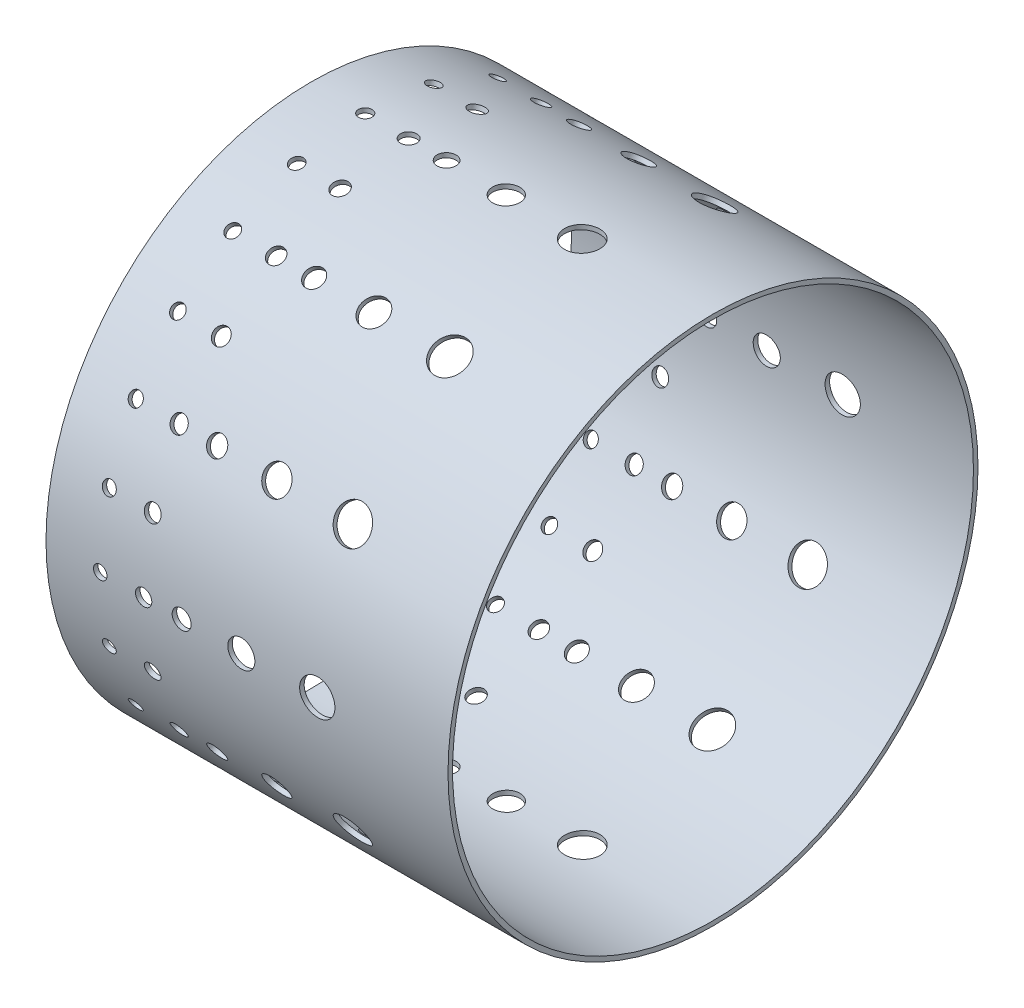
from build123d import *

# Parameters (mm, degrees)
SKETCH1_R           = 48.8442
SKETCH1_R_2         = 48.006
BOSS_EXTRUDE1_DEPTH = 74.09688
SKETCH2_R           = 1.25
CUT_EXTRUDE1_DEPTH  = 102.300835994
CIRPATTERN1_COUNT   = 24
SKETCH4_R           = 1.5
CUT_EXTRUDE2_DEPTH  = 102.300836166
CIRPATTERN2_COUNT   = 24
SKETCH5_R           = 1.75
CUT_EXTRUDE3_DEPTH  = 102.300836168
CIRPATTERN3_COUNT   = 12
SKETCH6_R           = 2.5
CUT_EXTRUDE4_DEPTH  = 102.300836173
CIRPATTERN4_COUNT   = 12
SKETCH7_R           = 3.25
CUT_EXTRUDE5_DEPTH  = 102.300836173
CIRPATTERN5_COUNT   = 12


with BuildPart() as part:
    # Sketch1 → Boss-Extrude1 (new body)
    with BuildSketch(Plane(origin=(0, 0, 0), x_dir=(0, 0, -1), z_dir=(1, 0, 0))):
        Circle(SKETCH1_R)
        Circle(SKETCH1_R_2, mode=Mode.SUBTRACT)
    extrude(amount=BOSS_EXTRUDE1_DEPTH)

    # Sketch2 → Cut-Extrude1 (cut, through all)
    with BuildSketch(Plane(origin=(0, 0, 0), x_dir=(1, 0, 0), z_dir=(0, 1, 0))):
        with Locations((10, 0)):
            Circle(SKETCH2_R)
    cut_extrude1 = extrude(amount=-CUT_EXTRUDE1_DEPTH, mode=Mode.SUBTRACT)

    # CirPattern1: Cut-Extrude1 ×24 about axis
    cirpattern1_axis = Axis((0, 0, 0), (1, 0, 0))
    for i in range(1, CIRPATTERN1_COUNT):
        add(cut_extrude1.rotate(cirpattern1_axis, i * 360 / CIRPATTERN1_COUNT), mode=Mode.SUBTRACT)

    # Sketch4 → Cut-Extrude2 (cut, through all)
    with BuildSketch(Plane.XY):
        with Locations((18, 0)):
            Circle(SKETCH4_R)
    cut_extrude2 = extrude(amount=-CUT_EXTRUDE2_DEPTH, mode=Mode.SUBTRACT)

    # CirPattern2: Cut-Extrude2 ×24 about axis
    cirpattern2_axis = Axis((0, 0, 0), (1, 0, 0))
    for i in range(1, CIRPATTERN2_COUNT):
        add(cut_extrude2.rotate(cirpattern2_axis, i * 360 / CIRPATTERN2_COUNT), mode=Mode.SUBTRACT)

    # Sketch5 → Cut-Extrude3 (cut, through all)
    with BuildSketch(Plane.XY):
        with Locations((25, 0)):
            Circle(SKETCH5_R)
    cut_extrude3 = extrude(amount=-CUT_EXTRUDE3_DEPTH, mode=Mode.SUBTRACT)

    # CirPattern3: Cut-Extrude3 ×12 about axis
    cirpattern3_axis = Axis((0, 0, 0), (1, 0, 0))
    for i in range(1, CIRPATTERN3_COUNT):
        add(cut_extrude3.rotate(cirpattern3_axis, i * 360 / CIRPATTERN3_COUNT), mode=Mode.SUBTRACT)

    # Sketch6 → Cut-Extrude4 (cut, through all)
    with BuildSketch(Plane.XY):
        with Locations((36, 0)):
            Circle(SKETCH6_R)
    cut_extrude4 = extrude(amount=-CUT_EXTRUDE4_DEPTH, mode=Mode.SUBTRACT)

    # CirPattern4: Cut-Extrude4 ×12 about axis
    cirpattern4_axis = Axis((0, 0, 0), (1, 0, 0))
    for i in range(1, CIRPATTERN4_COUNT):
        add(cut_extrude4.rotate(cirpattern4_axis, i * 360 / CIRPATTERN4_COUNT), mode=Mode.SUBTRACT)

    # Sketch7 → Cut-Extrude5 (cut, through all)
    with BuildSketch(Plane(origin=(0, 0, 0), x_dir=(1, 0, 0), z_dir=(0, 1, 0))):
        with Locations((50, 0)):
            Circle(SKETCH7_R)
    cut_extrude5 = extrude(amount=-CUT_EXTRUDE5_DEPTH, mode=Mode.SUBTRACT)

    # CirPattern5: Cut-Extrude5 ×12 about axis
    cirpattern5_axis = Axis((74.09688, 0, 0), (-1, 0, 0))
    for i in range(1, CIRPATTERN5_COUNT):
        add(cut_extrude5.rotate(cirpattern5_axis, i * 360 / CIRPATTERN5_COUNT), mode=Mode.SUBTRACT)


solid = part.part
